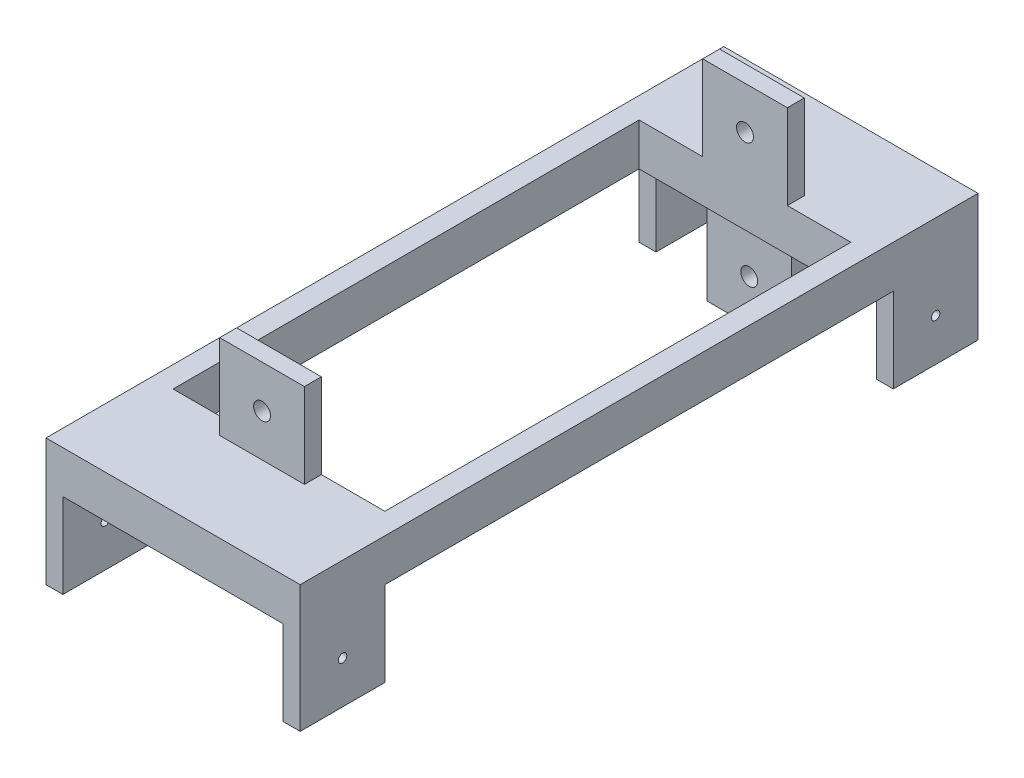
from build123d import *

# Parameters (mm, degrees)
SKETCH1_W               = 30
SKETCH1_H               = 80
BOSS_EXTRUDE1_DEPTH     = 5
SKETCH2_W               = 10
SKETCH2_H               = 10
BOSS_EXTRUDE2_DEPTH     = 30
CUT_EXTRUDE1_DEPTH      = 51.990195136
CUT_EXTRUDE1_DEPTH_BACK = 51.990195136
SKETCH3_R               = 0.5
CUT_EXTRUDE2_DEPTH      = 46.276925691
CUT_EXTRUDE2_DEPTH_BACK = 46.276925691
SKETCH4_W               = 25
SKETCH4_H               = 55
CUT_EXTRUDE3_DEPTH      = 83.006097334
CUT_EXTRUDE3_DEPTH_BACK = 83.006097334
SKETCH5_W               = 26
SKETCH5_H               = 10
SKETCH6_W               = 10
SKETCH6_H               = 10
BOSS_EXTRUDE3_DEPTH     = 80
CUT_EXTRUDE4_DEPTH      = 83.006097334
CUT_EXTRUDE4_DEPTH_BACK = 83.006097334
SKETCH7_R               = 1
CUT_EXTRUDE5_DEPTH      = 46.82575695
CUT_EXTRUDE5_DEPTH_BACK = 46.82575695
SKETCH8_W               = 56
SKETCH8_H               = 10
SKETCH9_W               = 10
SKETCH9_H               = 10
CUT_EXTRUDE6_DEPTH      = 10
SKETCH10_W              = 10
SKETCH10_H              = 10
CUT_EXTRUDE7_DEPTH      = 10
SKETCH12_W              = 10
SKETCH12_H              = 2
BOSS_EXTRUDE5_DEPTH     = 10
CUT_EXTRUDE8_DEPTH      = 73.665328734
CUT_EXTRUDE8_DEPTH_BACK = 73.665328734
SKETCH13_R              = 1


with BuildPart() as part:
    # Sketch1 → Boss-Extrude1 (new body)
    with BuildSketch(Plane(origin=(0, 0, 0), x_dir=(1, 0, 0), z_dir=(0, 1, 0))):
        Rectangle(SKETCH1_W, SKETCH1_H)
    extrude(amount=BOSS_EXTRUDE1_DEPTH)

    # Sketch2 → Boss-Extrude2 (add)
    with BuildSketch(Plane(origin=(15, 0, 0), x_dir=(0, 0, -1), z_dir=(1, 0, 0))):
        with Locations((-35, -5)):
            Rectangle(SKETCH2_W, SKETCH2_H)
        with Locations((35, -5)):
            Rectangle(SKETCH2_W, SKETCH2_H)
    extrude(amount=-BOSS_EXTRUDE2_DEPTH)

    # Sketch3 → Cut-Extrude1 (cut, two sides: drawn at the far end of the back side and taken through both)
    with BuildSketch(Plane(origin=(15, 0, 0), x_dir=(0, 0, -1), z_dir=(1, 0, 0)).offset(-CUT_EXTRUDE1_DEPTH_BACK)):
        with Locations((-35, -5)):
            Circle(SKETCH3_R)
        with Locations((35, -5)):
            Circle(SKETCH3_R)
    extrude(amount=CUT_EXTRUDE1_DEPTH + CUT_EXTRUDE1_DEPTH_BACK, mode=Mode.SUBTRACT)

    # Sketch4 → Cut-Extrude2 (cut, two sides: drawn at the far end of the back side and taken through both)
    with BuildSketch(Plane(origin=(0, 5, 0), x_dir=(1, 0, 0), z_dir=(0, 1, 0)).offset(-CUT_EXTRUDE2_DEPTH_BACK)):
        Rectangle(SKETCH4_W, SKETCH4_H)
    extrude(amount=CUT_EXTRUDE2_DEPTH + CUT_EXTRUDE2_DEPTH_BACK, mode=Mode.SUBTRACT)

    # Sketch5 → Cut-Extrude3 (cut, two sides: drawn at the far end of the back side and taken through both)
    with BuildSketch(Plane(origin=(0, 0, -40), x_dir=(-1, 0, 0), z_dir=(0, 0, -1)).offset(-CUT_EXTRUDE3_DEPTH_BACK)):
        with Locations((0, -5)):
            Rectangle(SKETCH5_W, SKETCH5_H)
    extrude(amount=CUT_EXTRUDE3_DEPTH + CUT_EXTRUDE3_DEPTH_BACK, mode=Mode.SUBTRACT)

    # Sketch6 → Boss-Extrude3 (add)
    with BuildSketch(Plane(origin=(0, 0, -40), x_dir=(-1, 0, 0), z_dir=(0, 0, -1))):
        with Locations((0, -5)):
            Rectangle(SKETCH6_W, SKETCH6_H)
    extrude(amount=-BOSS_EXTRUDE3_DEPTH)

    # Sketch7 → Cut-Extrude4 (cut, two sides: drawn at the far end of the back side and taken through both)
    with BuildSketch(Plane(origin=(0, 0, -40), x_dir=(-1, 0, 0), z_dir=(0, 0, -1)).offset(-CUT_EXTRUDE4_DEPTH_BACK)):
        with Locations((0, -5)):
            Circle(SKETCH7_R)
    extrude(amount=CUT_EXTRUDE4_DEPTH + CUT_EXTRUDE4_DEPTH_BACK, mode=Mode.SUBTRACT)

    # Sketch8 → Cut-Extrude5 (cut, two sides: drawn at the far end of the back side and taken through both)
    with BuildSketch(Plane(origin=(5, 0, 0), x_dir=(0, 0, -1), z_dir=(1, 0, 0)).offset(-CUT_EXTRUDE5_DEPTH_BACK)):
        with Locations((0, -5)):
            Rectangle(SKETCH8_W, SKETCH8_H)
    extrude(amount=CUT_EXTRUDE5_DEPTH + CUT_EXTRUDE5_DEPTH_BACK, mode=Mode.SUBTRACT)

    # Sketch9 → Cut-Extrude6 (cut)
    with BuildSketch(Plane.XY.offset(40)):
        with Locations((0, -5)):
            Rectangle(SKETCH9_W, SKETCH9_H)
    extrude(amount=-CUT_EXTRUDE6_DEPTH, mode=Mode.SUBTRACT)

    # Sketch10 → Cut-Extrude7 (cut)
    with BuildSketch(Plane(origin=(0, 0, -40), x_dir=(-1, 0, 0), z_dir=(0, 0, -1))):
        with Locations((0, -5)):
            Rectangle(SKETCH10_W, SKETCH10_H)
    extrude(amount=-CUT_EXTRUDE7_DEPTH, mode=Mode.SUBTRACT)

    # Sketch12 → Boss-Extrude5 (add)
    with BuildSketch(Plane(origin=(0, 5, 0), x_dir=(1, 0, 0), z_dir=(0, 1, 0))):
        with Locations((0, -28.5)):
            Rectangle(SKETCH12_W, SKETCH12_H)
        with Locations((0, 28.5)):
            Rectangle(SKETCH12_W, SKETCH12_H)
    extrude(amount=BOSS_EXTRUDE5_DEPTH)

    # Sketch13 → Cut-Extrude8 (cut, two sides: drawn at the far end of the back side and taken through both)
    with BuildSketch(Plane.XY.offset(29.5).offset(-CUT_EXTRUDE8_DEPTH_BACK)):
        with Locations((0, 10)):
            Circle(SKETCH13_R)
    extrude(amount=CUT_EXTRUDE8_DEPTH + CUT_EXTRUDE8_DEPTH_BACK, mode=Mode.SUBTRACT)


solid = part.part
